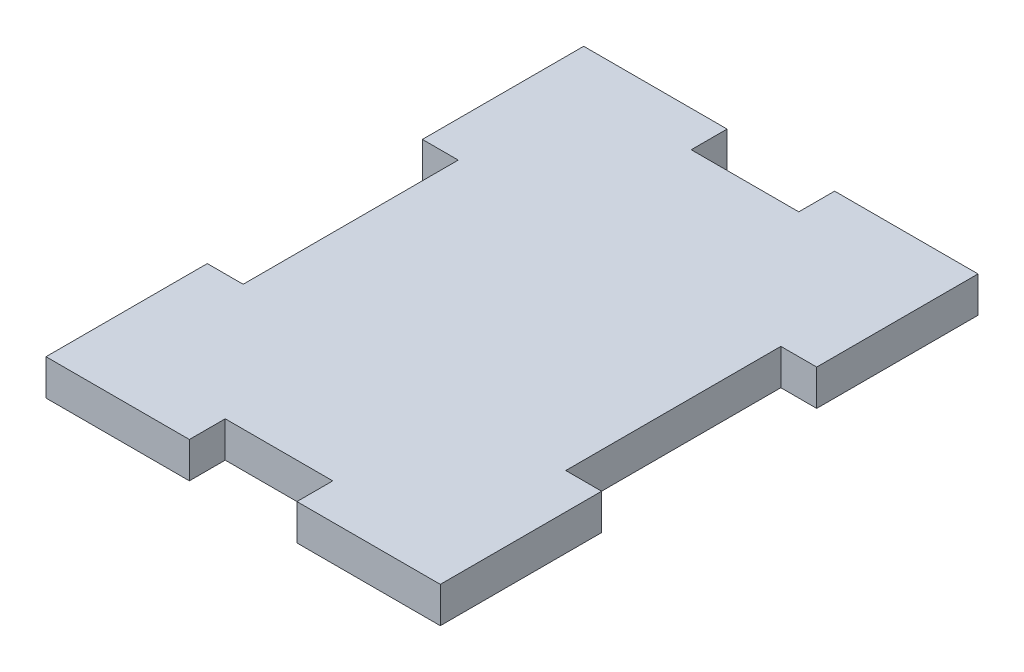
from build123d import *

# Parameters (mm, degrees)
SKETCH1_W               = 55
SKETCH1_H               = 75
BOSS_EXTRUDE1_DEPTH     = 5
CUT_EXTRUDE3_DEPTH      = 94.139680051
CUT_EXTRUDE3_DEPTH_BACK = 94.139680051
SKETCH5_W               = 5
SKETCH5_H               = 30
SKETCH5_W_2             = 15
SKETCH5_H_2             = 5


with BuildPart() as part:
    # Sketch1 → Boss-Extrude1 (new body)
    with BuildSketch(Plane(origin=(0, 0, 0), x_dir=(1, 0, 0), z_dir=(0, 1, 0))):
        with Locations((27.5, 37.5)):
            Rectangle(SKETCH1_W, SKETCH1_H)
    extrude(amount=BOSS_EXTRUDE1_DEPTH)

    # Sketch5 → Cut-Extrude3 (cut, two sides: drawn at the far end of the back side and taken through both)
    with BuildSketch(Plane(origin=(0, 5, 0), x_dir=(1, 0, 0), z_dir=(0, 1, 0)).offset(-CUT_EXTRUDE3_DEPTH_BACK)):
        with Locations((2.5, 37.5)):
            Rectangle(SKETCH5_W, SKETCH5_H)
        with Locations((27.5, 72.5)):
            Rectangle(SKETCH5_W_2, SKETCH5_H_2)
        with Locations((52.5, 37.5)):
            Rectangle(SKETCH5_W, SKETCH5_H)
        with Locations((27.5, 2.5)):
            Rectangle(SKETCH5_W_2, SKETCH5_H_2)
    extrude(amount=CUT_EXTRUDE3_DEPTH + CUT_EXTRUDE3_DEPTH_BACK, mode=Mode.SUBTRACT)


solid = part.part
